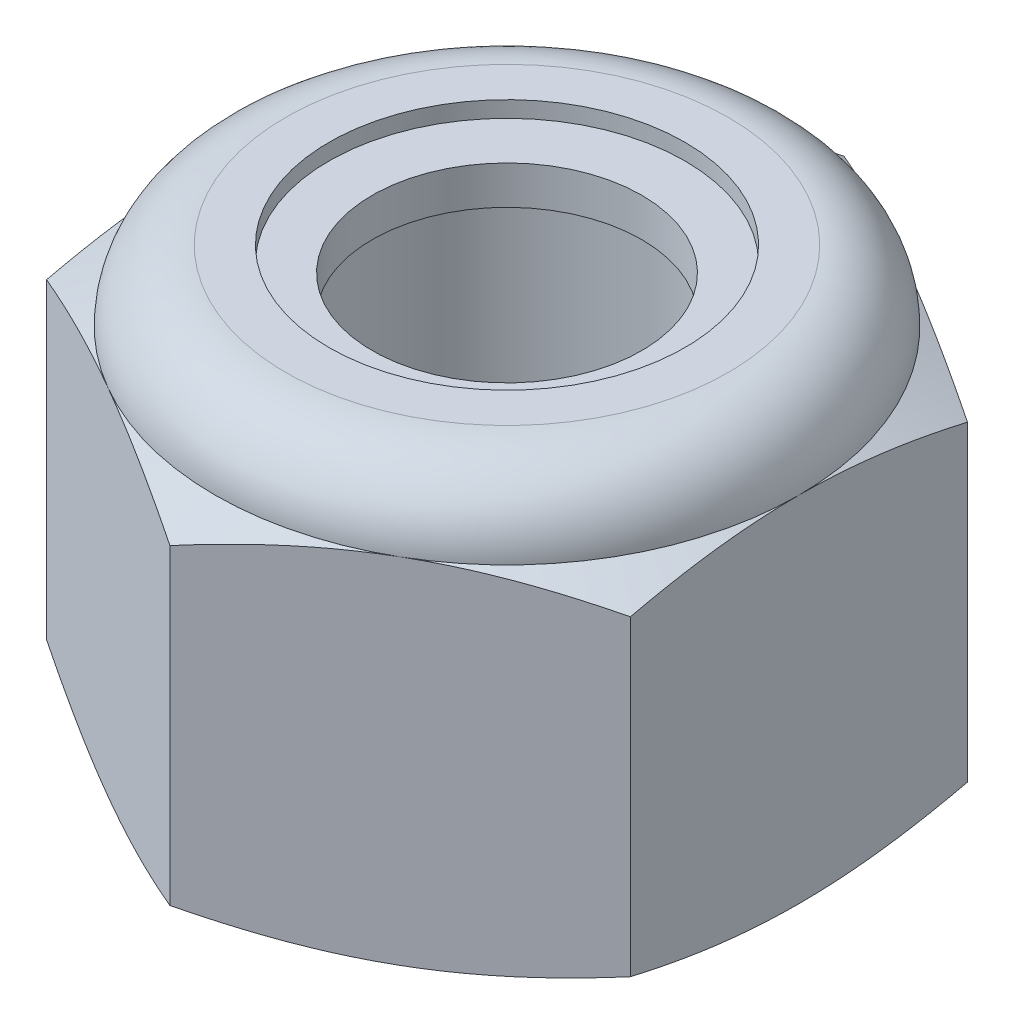
from build123d import *

# Parameters (mm, degrees)
EXTRUDE1_DEPTH = 4
SKETCH2_W      = 1.5
SKETCH2_H      = 4


with BuildPart() as part:
    # Sketch1 → Extrude1 (new body)
    with BuildSketch(Plane(origin=(0, 0, 0), x_dir=(1, 0, 0), z_dir=(0, 1, 0))):
        Polygon((0, 3.175426481), (-2.75, 1.58771324), (-2.75, -1.58771324), (0, -3.175426481), (2.75, -1.58771324), (2.75, 1.58771324), align=None)
    extrude(amount=EXTRUDE1_DEPTH)

    # Sketch4 → Cut-Revolve2 (revolve, cut)
    with BuildSketch(Plane(origin=(0, 0, 0), x_dir=(0, 0, -1), z_dir=(1, 0, 0))):
        Polygon((0, 4), (1.5, 4), (1.269011592, 3.892288336), (1.269011592, 0.107711664), (1.5, 0), (0, 0), align=None)
    revolve(axis=Axis((0, 4, 0), (0, 1, 0)), mode=Mode.SUBTRACT)


with BuildPart() as body_2:
    # Sketch2 → Revolve1 (revolve)
    with BuildSketch(Plane(origin=(0, 0, 0), x_dir=(0, 0, -1), z_dir=(1, 0, 0))):
        with Locations((0.75, 2)):
            Rectangle(SKETCH2_W, SKETCH2_H)
    revolve(axis=Axis((0, -1.5, 0), (0, 1, 0)))


with BuildPart() as part_1:
    add(part.part)

    # Combine1: cut body 2
    add(body_2.part, mode=Mode.SUBTRACT)

    # Sketch5 → Cut-Revolve3 (revolve, cut)
    with BuildSketch(Plane(origin=(0, 0, 0), x_dir=(0, 0, -1), z_dir=(1, 0, 0))):
        with BuildLine():
            Line((0, 0), (2.75, 0))
            Line((2.75, 0), (3.175426481, 0.198379626))
            Line((3.175426481, 0.198379626), (3.175426481, 3.134953707))
            Line((3.175426481, 3.134953707), (2.75, 3.333333333))
            ThreePointArc((2.75, 3.333333333), (2.554737854, 3.804737854), (2.083333333, 4))
            Line((2.083333333, 4), (2.083333333, 5.27))
            Line((2.083333333, 5.27), (4.445426481, 5.27))
            Line((4.445426481, 5.27), (4.445426481, -1.27))
            Line((4.445426481, -1.27), (0, -1.27))
            Line((0, -1.27), (0, 0))
        make_face()
    revolve(axis=Axis((0, 0, 0), (0, 1, 0)), mode=Mode.SUBTRACT)

    # Sketch6 → Cut-Revolve4 (revolve, cut)
    with BuildSketch(Plane(origin=(0, 0, 0), x_dir=(0, 0, -1), z_dir=(1, 0, 0))):
        with BuildLine():
            Line((0, 3.333333333), (2.5976, 3.333333333))
            ThreePointArc((2.5976, 3.333333333), (2.446974781, 3.696974781), (2.083333333, 3.8476))
            Line((2.083333333, 3.8476), (1.676172463, 3.8476))
            Line((1.676172463, 3.8476), (1.676172463, 5.27))
            Line((1.676172463, 5.27), (0, 5.27))
            Line((0, 5.27), (0, 3.333333333))
        make_face()
    revolve(axis=Axis((0, 5.27, 0), (0, 1, 0)), mode=Mode.SUBTRACT)


with BuildPart() as body_2_2:
    # Sketch7 → Revolve2 (revolve)
    with BuildSketch(Plane(origin=(0, 0, 0), x_dir=(0, 0, -1), z_dir=(1, 0, 0))):
        with BuildLine():
            Line((1.269011592, 3.409533333), (2.514721748, 3.409533333))
            ThreePointArc((2.514721748, 3.409533333), (2.36486639, 3.668954462), (2.083333333, 3.7714))
            Line((2.083333333, 3.7714), (1.269011592, 3.7714))
            Line((1.269011592, 3.7714), (1.269011592, 3.409533333))
        make_face()
    revolve(axis=Axis((0, 3.409533333, 0), (0, 1, 0)))


solid = Compound([part_1.part, body_2_2.part])
